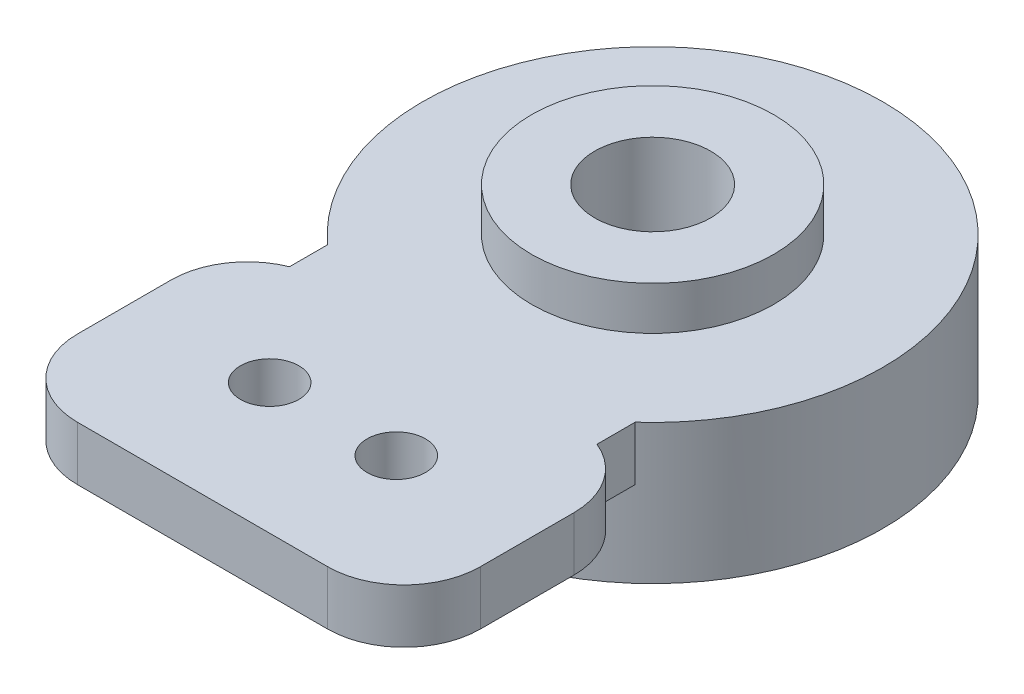
from build123d import *

# Parameters (mm, degrees)
BOSS_EXTRUDE1_DEPTH = 2.83
BOSS_EXTRUDE2_START = 4.48
SKETCH2_R           = 12.05
BOSS_EXTRUDE2_DEPTH = 4.48
SKETCH3_R           = 6.34
BOSS_EXTRUDE3_DEPTH = 2.27
SKETCH4_R           = 3.035
CUT_EXTRUDE1_DEPTH  = 29.151799232
SKETCH5_R           = 1.53
CUT_EXTRUDE2_DEPTH  = 28.46240157


with BuildPart() as part:
    # Sketch1 → Boss-Extrude1 (new body)
    with BuildSketch(Plane(origin=(0, 0, 0), x_dir=(1, 0, 0), z_dir=(0, 1, 0))):
        with BuildLine():
            Line((-6.55, -23.57), (6.55, -23.57))
            ThreePointArc((6.55, -23.57), (9.378427125, -22.398427125), (10.55, -19.57))
            Line((10.55, -19.57), (10.55, -14.674703952))
            ThreePointArc((10.55, -14.674703952), (9.86662479, -12.438635975), (8.05, -10.966604709))
            Line((8.05, -10.966604709), (8.05, -8.966604709))
            ThreePointArc((8.05, -8.966604709), (0, 12.05), (-8.05, -8.966604709))
            Line((-8.05, -8.966604709), (-8.05, -10.966604709))
            ThreePointArc((-8.05, -10.966604709), (-9.86662479, -12.438635975), (-10.55, -14.674703952))
            Line((-10.55, -14.674703952), (-10.55, -19.57))
            ThreePointArc((-10.55, -19.57), (-9.378427125, -22.398427125), (-6.55, -23.57))
        make_face()
    extrude(amount=BOSS_EXTRUDE1_DEPTH)

    # Sketch2 → Boss-Extrude2 (add)
    with BuildSketch(Plane.XZ.offset(BOSS_EXTRUDE2_START)):
        Circle(SKETCH2_R)
    extrude(amount=-BOSS_EXTRUDE2_DEPTH)

    # Sketch3 → Boss-Extrude3 (add)
    with BuildSketch(Plane(origin=(0, 2.83, 0), x_dir=(1, 0, 0), z_dir=(0, 1, 0))):
        Circle(SKETCH3_R)
    extrude(amount=BOSS_EXTRUDE3_DEPTH)

    # Sketch4 → Cut-Extrude1 (cut, through all)
    with BuildSketch(Plane(origin=(0, 5.1, 0), x_dir=(1, 0, 0), z_dir=(0, 1, 0))):
        Circle(SKETCH4_R)
    extrude(amount=-CUT_EXTRUDE1_DEPTH, mode=Mode.SUBTRACT)

    # Sketch5 → Cut-Extrude2 (cut, through all)
    with BuildSketch(Plane(origin=(0, 2.83, 0), x_dir=(1, 0, 0), z_dir=(0, 1, 0))):
        with Locations((-3.315, -16.74)):
            Circle(SKETCH5_R)
        with Locations((3.315, -16.74)):
            Circle(SKETCH5_R)
    extrude(amount=-CUT_EXTRUDE2_DEPTH, mode=Mode.SUBTRACT)


solid = part.part
